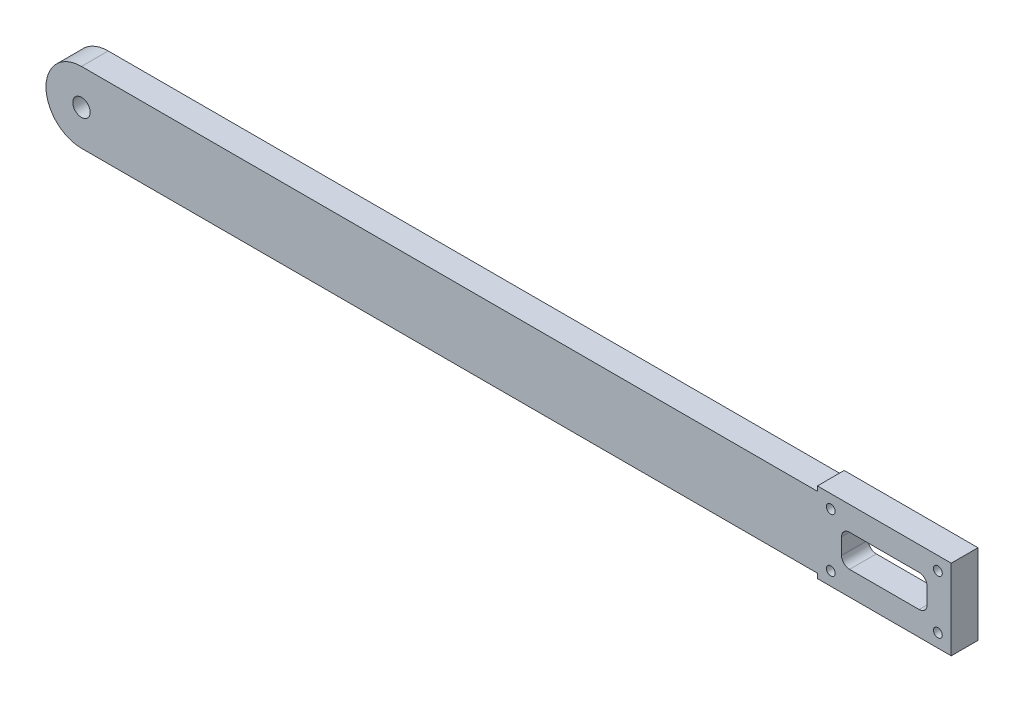
from build123d import *

# Parameters (mm, degrees)
SKETCH1_R      = 3.25
SKETCH1_R_2    = 1.65
MAIN_ARM_DEPTH = 10


with BuildPart() as part:
    # Sketch1 → Main Arm (new body)
    with BuildSketch(Plane.XY):
        with BuildLine():
            Line((275, 13.25), (0, 13.25))
            ThreePointArc((0, 13.25), (-13.25, 0), (0, -13.25))
            Line((0, -13.25), (275, -13.25))
            Line((275, -13.25), (275, -15))
            Line((275, -15), (325, -15))
            Line((325, -15), (325, 15))
            Line((325, 15), (275, 15))
            Line((275, 15), (275, 13.25))
        make_face()
        Circle(SKETCH1_R, mode=Mode.SUBTRACT)
        with BuildLine():
            Line((287, 6), (313, 6))
            ThreePointArc((313, 6), (315.121320344, 5.121320344), (316, 3))
            Line((316, 3), (316, -3))
            ThreePointArc((316, -3), (315.121320344, -5.121320344), (313, -6))
            Line((313, -6), (287, -6))
            ThreePointArc((287, -6), (284.878679656, -5.121320344), (284, -3))
            Line((284, -3), (284, 3))
            ThreePointArc((284, 3), (284.878679656, 5.121320344), (287, 6))
        make_face(mode=Mode.SUBTRACT)
        with Locations((280, 10)):
            Circle(SKETCH1_R_2, mode=Mode.SUBTRACT)
        with Locations((280, -10)):
            Circle(SKETCH1_R_2, mode=Mode.SUBTRACT)
        with Locations((320, -10)):
            Circle(SKETCH1_R_2, mode=Mode.SUBTRACT)
        with Locations((320, 10)):
            Circle(SKETCH1_R_2, mode=Mode.SUBTRACT)
    extrude(amount=MAIN_ARM_DEPTH)


solid = part.part
